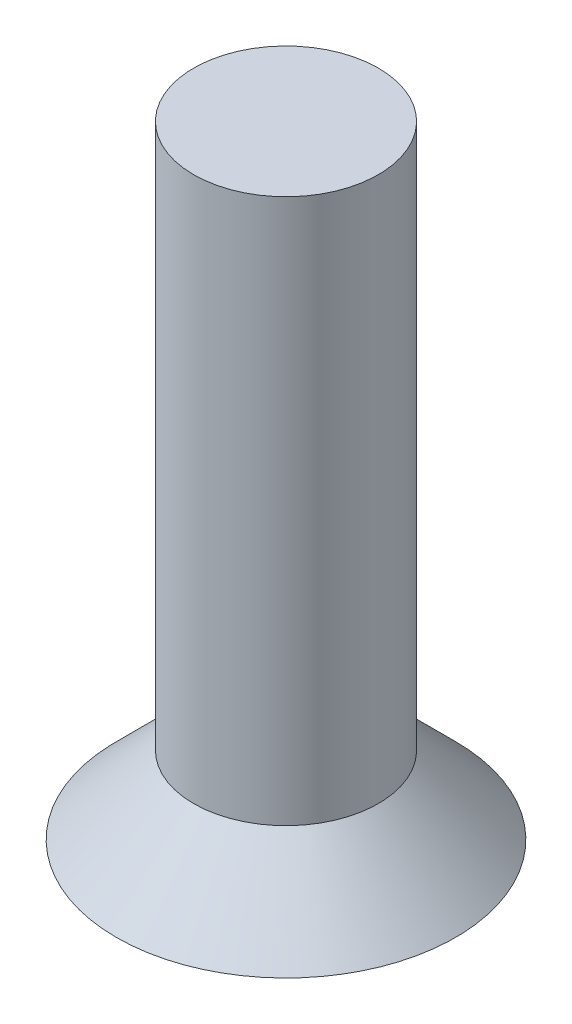
from build123d import *

# Parameters (mm, degrees)
SKETCH1_R           = 4.5
BOSS_EXTRUDE1_DEPTH = 2.5
SKETCH2_R           = 2.45
BOSS_EXTRUDE2_DEPTH = 14
CHAMFER1_SIZE       = 2.5
CUT_EXTRUDE1_DEPTH  = 1.5


with BuildPart() as part:
    # Sketch1 → Boss-Extrude1 (new body)
    with BuildSketch(Plane(origin=(0, 0, 0), x_dir=(1, 0, 0), z_dir=(0, 1, 0))):
        with Locations(Location((0, 0, 0), (0, 0, 270))):
            Circle(SKETCH1_R)
    extrude(amount=BOSS_EXTRUDE1_DEPTH)

    # Sketch2 → Boss-Extrude2 (add)
    with BuildSketch(Plane(origin=(0, 2.5, 0), x_dir=(1, 0, 0), z_dir=(0, 1, 0))):
        with Locations(Location((0, 0, 0), (0, 0, 270))):
            Circle(SKETCH2_R)
    extrude(amount=BOSS_EXTRUDE2_DEPTH)

    # Chamfer1
    # the kernel refuses this chamfer: 2.5 mm, written as the material it takes off along each edge
    with BuildSketch(Plane(origin=(0, 2.5, 0), x_dir=(0, 0, 1), z_dir=(-1, 0, 0))) as chamfer1_piece_1_section:
        Polygon((4.5, -CHAMFER1_SIZE), (4.5 - CHAMFER1_SIZE, 0), (4.5, 0), align=None)
    chamfer1_piece_1 = revolve(axis=Axis((0, 2.5, 0), (0, 1, 0)), mode=Mode.PRIVATE)
    chamfer1_piece_1 = chamfer1_piece_1 - Plane(origin=(0, 1.019761833, 0), x_dir=(0, 0, 1), z_dir=(0, -1, 0)) * Cylinder(2.45, 18, mode=Mode.PRIVATE)
    add(chamfer1_piece_1, mode=Mode.SUBTRACT)

    # Sketch3 → Cut-Extrude1 (cut)
    with BuildSketch(Plane.XZ):
        Polygon((0, -1.662470902), (1.439742034, -0.831235451), (1.439742034, 0.831235451), (0, 1.662470902), (-1.439742034, 0.831235451), (-1.439742034, -0.831235451), align=None)
    extrude(amount=-CUT_EXTRUDE1_DEPTH, mode=Mode.SUBTRACT)


solid = part.part
